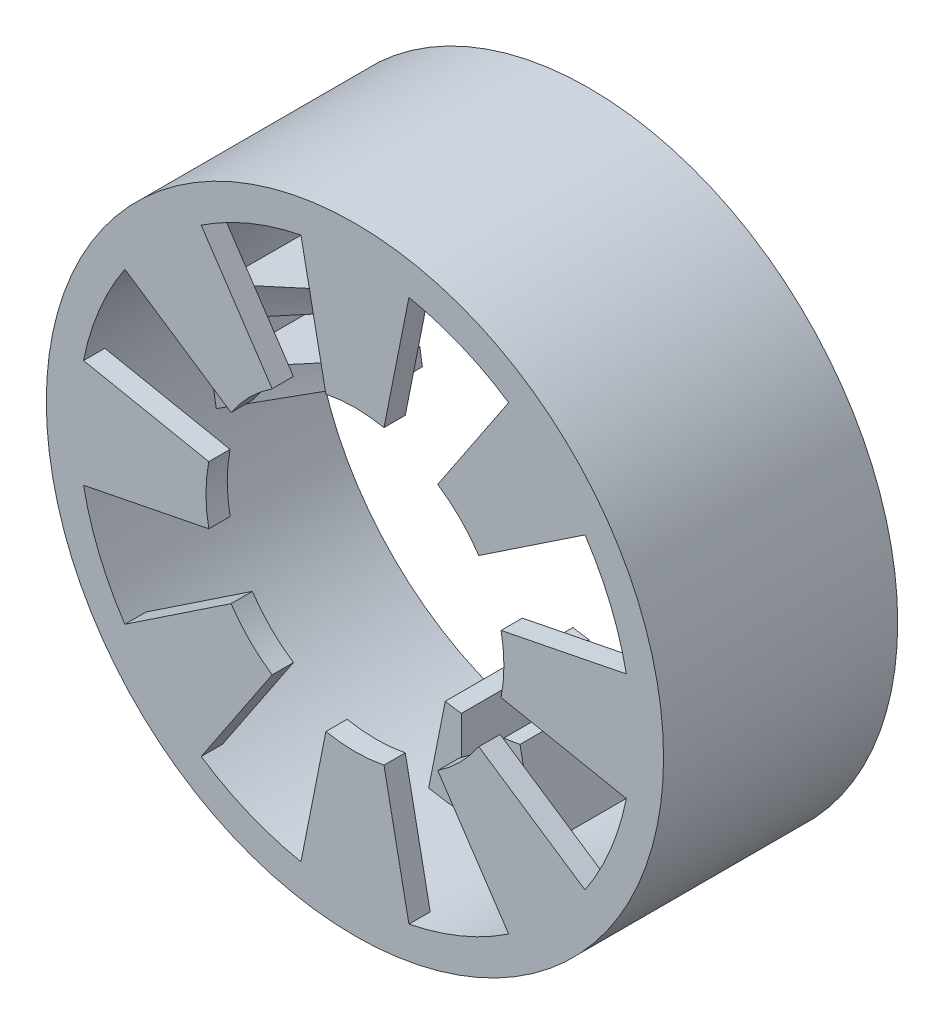
from build123d import *

# Parameters (mm, degrees)
SKETCH1_R             = 14.5
BOSS_EXTRUDE1_DEPTH   = 1
BOSS_EXTRUDE2_START   = 6
BOSS_EXTRUDE2_DEPTH   = 6
BOSS_EXTRUDE2_2_DEPTH = 6
BOSS_EXTRUDE2_3_DEPTH = 6
BOSS_EXTRUDE2_4_DEPTH = 6
BOSS_EXTRUDE2_5_DEPTH = 6
BOSS_EXTRUDE2_6_DEPTH = 6
BOSS_EXTRUDE2_7_DEPTH = 6
BOSS_EXTRUDE2_8_DEPTH = 6
BOSS_EXTRUDE3_START   = 10
SKETCH3_R             = 14.5
SKETCH3_R_2           = 13
BOSS_EXTRUDE3_DEPTH   = 10
CHAMFER1_SIZE         = 5
CHAMFER1_SIZE_2       = 4.195498156
CHAMFER2_SIZE         = 5
CHAMFER2_SIZE_2       = 4.195498156


with BuildPart() as part:
    # Sketch1 → Boss-Extrude1 (new body)
    with BuildSketch(Plane.XY):
        Circle(SKETCH1_R)
        with BuildLine():
            ThreePointArc((-1.365632254, 6.865496963), (0, 7), (1.365632254, 6.865496963))
            Line((1.365632254, 6.865496963), (2.536174186, 12.750208645))
            ThreePointArc((2.536174186, 12.750208645), (4.974884621, 12.010433923), (7.222413029, 10.80910496))
            Line((7.222413029, 10.80910496), (3.888991631, 5.820287286))
            ThreePointArc((3.888991631, 5.820287286), (4.949747468, 4.949747468), (5.820287286, 3.888991631))
            Line((5.820287286, 3.888991631), (10.80910496, 7.222413029))
            ThreePointArc((10.80910496, 7.222413029), (12.010433923, 4.974884621), (12.750208645, 2.536174186))
            Line((12.750208645, 2.536174186), (6.865496963, 1.365632254))
            ThreePointArc((6.865496963, 1.365632254), (7, 0), (6.865496963, -1.365632254))
            Line((6.865496963, -1.365632254), (12.750208645, -2.536174186))
            ThreePointArc((12.750208645, -2.536174186), (12.010433923, -4.974884621), (10.80910496, -7.222413029))
            Line((10.80910496, -7.222413029), (5.820287286, -3.888991631))
            ThreePointArc((5.820287286, -3.888991631), (4.949747468, -4.949747468), (3.888991631, -5.820287286))
            Line((3.888991631, -5.820287286), (7.222413029, -10.80910496))
            ThreePointArc((7.222413029, -10.80910496), (4.974884621, -12.010433923), (2.536174186, -12.750208645))
            Line((2.536174186, -12.750208645), (1.365632254, -6.865496963))
            ThreePointArc((1.365632254, -6.865496963), (0, -7), (-1.365632254, -6.865496963))
            Line((-1.365632254, -6.865496963), (-2.536174186, -12.750208645))
            ThreePointArc((-2.536174186, -12.750208645), (-4.974884621, -12.010433923), (-7.222413029, -10.80910496))
            Line((-7.222413029, -10.80910496), (-3.888991631, -5.820287286))
            ThreePointArc((-3.888991631, -5.820287286), (-4.949747468, -4.949747468), (-5.820287286, -3.888991631))
            Line((-5.820287286, -3.888991631), (-10.80910496, -7.222413029))
            ThreePointArc((-10.80910496, -7.222413029), (-12.010433923, -4.974884621), (-12.750208645, -2.536174186))
            Line((-12.750208645, -2.536174186), (-6.865496963, -1.365632254))
            ThreePointArc((-6.865496963, -1.365632254), (-7, 0), (-6.865496963, 1.365632254))
            Line((-6.865496963, 1.365632254), (-12.750208645, 2.536174186))
            ThreePointArc((-12.750208645, 2.536174186), (-12.010433923, 4.974884621), (-10.80910496, 7.222413029))
            Line((-10.80910496, 7.222413029), (-5.820287286, 3.888991631))
            ThreePointArc((-5.820287286, 3.888991631), (-4.949747468, 4.949747468), (-3.888991631, 5.820287286))
            Line((-3.888991631, 5.820287286), (-7.222413029, 10.80910496))
            ThreePointArc((-7.222413029, 10.80910496), (-4.974884621, 12.010433923), (-2.536174186, 12.750208645))
            Line((-2.536174186, 12.750208645), (-1.365632254, 6.865496963))
        make_face(mode=Mode.SUBTRACT)
    extrude(amount=BOSS_EXTRUDE1_DEPTH)

    # Sketch3 → Boss-Extrude3 (add)
    with BuildSketch(Plane(origin=(0, 0, 0), x_dir=(-1, 0, 0), z_dir=(0, 0, -1)).offset(BOSS_EXTRUDE3_START)):
        Circle(SKETCH3_R)
        Circle(SKETCH3_R_2, mode=Mode.SUBTRACT)
    extrude(amount=-BOSS_EXTRUDE3_DEPTH)


with BuildPart() as body_2:
    # Sketch2 → Boss-Extrude2 (new body)
    with BuildSketch(Plane(origin=(0, 0, -5), x_dir=(-1, 0, 0), z_dir=(0, 0, -1)).offset(BOSS_EXTRUDE2_START)):
        with BuildLine():
            ThreePointArc((1, 8.94427191), (1.379152058, 8.893702244), (1.755812898, 8.827067524))
            Line((1.755812898, 8.827067524), (2.536174186, 12.750208645))
            ThreePointArc((2.536174186, 12.750208645), (1.771239965, 12.8787697), (1, 12.961481397))
            Line((1, 12.961481397), (1, 8.94427191))
        make_face()
    extrude(amount=-BOSS_EXTRUDE2_DEPTH)


with BuildPart() as body_3:
    # Sketch2 → Boss-Extrude2 2 (new body)
    with BuildSketch(Plane(origin=(0, 0, -5), x_dir=(-1, 0, 0), z_dir=(0, 0, -1)).offset(BOSS_EXTRUDE2_START)):
        with BuildLine():
            ThreePointArc((-1.755812898, 8.827067524), (-1.379152058, 8.893702244), (-1, 8.94427191))
            Line((-1, 8.94427191), (-1, 12.961481397))
            ThreePointArc((-1, 12.961481397), (-1.771239965, 12.8787697), (-2.536174186, 12.750208645))
            Line((-2.536174186, 12.750208645), (-1.755812898, 8.827067524))
        make_face()
    extrude(amount=-BOSS_EXTRUDE2_2_DEPTH)


with BuildPart() as body_4:
    # Sketch2 → Boss-Extrude2 3 (new body)
    with BuildSketch(Plane(origin=(0, 0, -5), x_dir=(-1, 0, 0), z_dir=(0, 0, -1)).offset(BOSS_EXTRUDE2_START)):
        with BuildLine():
            ThreePointArc((-8.94427191, 1), (-8.893702244, 1.379152058), (-8.827067524, 1.755812898))
            Line((-8.827067524, 1.755812898), (-12.750208645, 2.536174186))
            ThreePointArc((-12.750208645, 2.536174186), (-12.8787697, 1.771239965), (-12.961481397, 1))
            Line((-12.961481397, 1), (-8.94427191, 1))
        make_face()
    extrude(amount=-BOSS_EXTRUDE2_3_DEPTH)


with BuildPart() as body_5:
    # Sketch2 → Boss-Extrude2 4 (new body)
    with BuildSketch(Plane(origin=(0, 0, -5), x_dir=(-1, 0, 0), z_dir=(0, 0, -1)).offset(BOSS_EXTRUDE2_START)):
        with BuildLine():
            ThreePointArc((-8.827067524, -1.755812898), (-8.893702244, -1.379152058), (-8.94427191, -1))
            Line((-8.94427191, -1), (-12.961481397, -1))
            ThreePointArc((-12.961481397, -1), (-12.8787697, -1.771239965), (-12.750208645, -2.536174186))
            Line((-12.750208645, -2.536174186), (-8.827067524, -1.755812898))
        make_face()
    extrude(amount=-BOSS_EXTRUDE2_4_DEPTH)


with BuildPart() as body_6:
    # Sketch2 → Boss-Extrude2 5 (new body)
    with BuildSketch(Plane(origin=(0, 0, -5), x_dir=(-1, 0, 0), z_dir=(0, 0, -1)).offset(BOSS_EXTRUDE2_START)):
        with BuildLine():
            Line((-1, -12.961481397), (-1, -8.94427191))
            ThreePointArc((-1, -8.94427191), (-1.379152058, -8.893702244), (-1.755812898, -8.827067524))
            Line((-1.755812898, -8.827067524), (-2.536174186, -12.750208645))
            ThreePointArc((-2.536174186, -12.750208645), (-1.771239965, -12.8787697), (-1, -12.961481397))
        make_face()
    extrude(amount=-BOSS_EXTRUDE2_5_DEPTH)


with BuildPart() as body_7:
    # Sketch2 → Boss-Extrude2 6 (new body)
    with BuildSketch(Plane(origin=(0, 0, -5), x_dir=(-1, 0, 0), z_dir=(0, 0, -1)).offset(BOSS_EXTRUDE2_START)):
        with BuildLine():
            Line((2.536174186, -12.750208645), (1.755812898, -8.827067524))
            ThreePointArc((1.755812898, -8.827067524), (1.379152058, -8.893702244), (1, -8.94427191))
            Line((1, -8.94427191), (1, -12.961481397))
            ThreePointArc((1, -12.961481397), (1.771239965, -12.8787697), (2.536174186, -12.750208645))
        make_face()
    extrude(amount=-BOSS_EXTRUDE2_6_DEPTH)


with BuildPart() as body_8:
    # Sketch2 → Boss-Extrude2 7 (new body)
    with BuildSketch(Plane(origin=(0, 0, -5), x_dir=(-1, 0, 0), z_dir=(0, 0, -1)).offset(BOSS_EXTRUDE2_START)):
        with BuildLine():
            Line((12.961481397, -1), (8.94427191, -1))
            ThreePointArc((8.94427191, -1), (8.893702244, -1.379152058), (8.827067524, -1.755812898))
            Line((8.827067524, -1.755812898), (12.750208645, -2.536174186))
            ThreePointArc((12.750208645, -2.536174186), (12.8787697, -1.771239965), (12.961481397, -1))
        make_face()
    extrude(amount=-BOSS_EXTRUDE2_7_DEPTH)

    # Chamfer1
    # the kernel refuses this chamfer: 5, 4.195498156 mm, written as the material it takes off along each edge
    with BuildSketch(Plane(origin=(0, 0, -5), x_dir=(-0.24763976324851328, 0.9688521804992858, 0), z_dir=(0.9688521804992858, 0.24763976324851328, 0))) as chamfer1_piece_1:
        Polygon((9, -CHAMFER1_SIZE), (9 + CHAMFER1_SIZE_2, 0), (9, 0), align=None)
    revolve(axis=Axis((0, 0, -5), (0, 0, 1)), revolution_arc=168.953591464, mode=Mode.SUBTRACT)


with BuildPart() as body_9:
    # Sketch2 → Boss-Extrude2 8 (new body)
    with BuildSketch(Plane(origin=(0, 0, -5), x_dir=(-1, 0, 0), z_dir=(0, 0, -1)).offset(BOSS_EXTRUDE2_START)):
        with BuildLine():
            Line((12.750208645, 2.536174186), (8.827067524, 1.755812898))
            ThreePointArc((8.827067524, 1.755812898), (8.893702244, 1.379152058), (8.94427191, 1))
            Line((8.94427191, 1), (12.961481397, 1))
            ThreePointArc((12.961481397, 1), (12.8787697, 1.771239965), (12.750208645, 2.536174186))
        make_face()
    extrude(amount=-BOSS_EXTRUDE2_8_DEPTH)

    # Chamfer2
    # the kernel refuses this chamfer: 5, 4.195498156 mm, written as the material it takes off along each edge
    with BuildSketch(Plane(origin=(0, 0, -5), x_dir=(0.05741558541416482, 0.9983503646273431, 0), z_dir=(0.9983503646273431, -0.05741558541416482, 0))) as chamfer2_piece_1:
        Polygon((9, -CHAMFER2_SIZE), (9 + CHAMFER2_SIZE_2, 0), (9, 0), align=None)
    revolve(axis=Axis((0, 0, -5), (0, 0, 1)), revolution_arc=168.953591464, mode=Mode.SUBTRACT)


solid = Compound([part.part, body_2.part, body_3.part, body_4.part, body_5.part, body_6.part, body_7.part, body_8.part, body_9.part])
